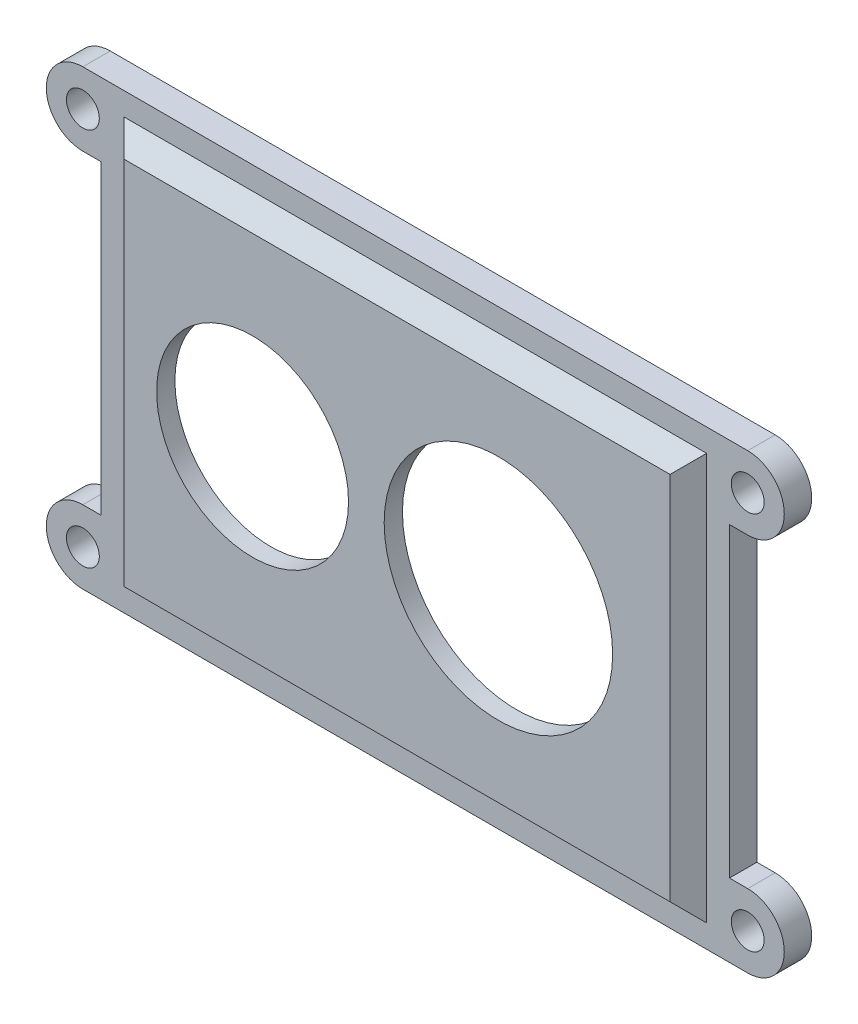
from build123d import *

# Parameters (mm, degrees)
ESBO_O1_W                = 68.75
ESBO_O1_H                = 49.5
RESSALTO_EXTRUS_O1_DEPTH = 5
ESBO_O2_W                = 60.75
ESBO_O2_H                = 41
CORTE_EXTRUS_O1_DEPTH    = 3
ESBO_O3_R                = 1.8
RESSALTO_EXTRUS_O2_DEPTH = 3
ESBO_O4_W                = 68.75
ESBO_O4_H                = 49.5
ESBO_O4_W_2              = 63.75
ESBO_O4_H_2              = 44.5
CORTE_EXTRUS_O2_DEPTH    = 2
CHANFRO1_SIZE            = 2
ESBO_O6_R                = 10.499996118
ESBO_O6_R_2              = 12.499999064
CORTE_EXTRUS_O4_DEPTH    = 48.620406603


with BuildPart() as part:
    # Esboço1 → Ressalto-extrusão1 (new body)
    with BuildSketch(Plane.XY):
        Rectangle(ESBO_O1_W, ESBO_O1_H)
    extrude(amount=RESSALTO_EXTRUS_O1_DEPTH)

    # Esboço2 → Corte-extrusão1 (cut)
    with BuildSketch(Plane(origin=(0, 0, 0), x_dir=(-1, 0, 0), z_dir=(0, 0, -1))):
        Rectangle(ESBO_O2_W, ESBO_O2_H)
    extrude(amount=-CORTE_EXTRUS_O1_DEPTH, mode=Mode.SUBTRACT)

    # Esboço3 → Ressalto-extrusão2 (add)
    # profile 1 of 4: a face of its own
    with BuildSketch(Plane(origin=(0, 0, 0), x_dir=(-1, 0, 0), z_dir=(0, 0, -1))):
        with BuildLine():
            Line((-36.375, 24.75), (-34.375, 24.75))
            Line((-34.375, 24.75), (-34.375, 16.75))
            Line((-34.375, 16.75), (-36.375, 16.75))
            ThreePointArc((-36.375, 16.75), (-40.375, 20.75), (-36.375, 24.75))
        make_face()
        with Locations((-36.375, 20.75)):
            Circle(ESBO_O3_R, mode=Mode.SUBTRACT)
    # profile 2 of 4: a face of its own
    with BuildSketch(Plane(origin=(0, 0, 0), x_dir=(-1, 0, 0), z_dir=(0, 0, -1))):
        with BuildLine():
            Line((34.375, 16.75), (36.375, 16.75))
            ThreePointArc((36.375, 16.75), (40.375, 20.75), (36.375, 24.75))
            Line((36.375, 24.75), (34.375, 24.75))
            Line((34.375, 24.75), (34.375, 16.75))
        make_face()
        with Locations(Location((36.375, 20.75, 0), (0, 0, 180))):
            Circle(ESBO_O3_R, mode=Mode.SUBTRACT)
    # profile 3 of 4: a face of its own
    with BuildSketch(Plane(origin=(0, 0, 0), x_dir=(-1, 0, 0), z_dir=(0, 0, -1))):
        with BuildLine():
            Line((36.375, -24.75), (34.375, -24.75))
            Line((34.375, -24.75), (34.375, -16.75))
            Line((34.375, -16.75), (36.375, -16.75))
            ThreePointArc((36.375, -16.75), (40.375, -20.75), (36.375, -24.75))
        make_face()
        with Locations((36.375, -20.75)):
            Circle(ESBO_O3_R, mode=Mode.SUBTRACT)
    # profile 4 of 4: a face of its own
    with BuildSketch(Plane(origin=(0, 0, 0), x_dir=(-1, 0, 0), z_dir=(0, 0, -1))):
        with BuildLine():
            Line((-34.375, -16.75), (-36.375, -16.75))
            ThreePointArc((-36.375, -16.75), (-40.375, -20.75), (-36.375, -24.75))
            Line((-36.375, -24.75), (-34.375, -24.75))
            Line((-34.375, -24.75), (-34.375, -16.75))
        make_face()
        with Locations(Location((-36.375, -20.75, 0), (0, 0, 180))):
            Circle(ESBO_O3_R, mode=Mode.SUBTRACT)
    extrude(amount=-RESSALTO_EXTRUS_O2_DEPTH)

    # Esboço4 → Corte-extrusão2 (cut)
    with BuildSketch(Plane.XY.offset(5)):
        Rectangle(ESBO_O4_W, ESBO_O4_H)
        Rectangle(ESBO_O4_W_2, ESBO_O4_H_2, mode=Mode.SUBTRACT)
    extrude(amount=-CORTE_EXTRUS_O2_DEPTH, mode=Mode.SUBTRACT)

    # Chanfro1
    chanfro1_edges = [part.edges().sort_by_distance(p)[0] for p in [
        (31.875, 0, 5),
        (0, -22.25, 5),
        (-31.875, 0, 5),
        (0, 22.25, 5),
    ]]
    chamfer(chanfro1_edges, length=CHANFRO1_SIZE - 0.0001)  # a hair under: the kernel refuses the full size

    # Esboço6 → Corte-extrusão4 (cut, through all)
    with BuildSketch(Plane.XY.offset(5)):
        with Locations((-15.805529429, 0.050006416)):
            Circle(ESBO_O6_R)
        with Locations((11.094471539, 0.049998219)):
            Circle(ESBO_O6_R_2)
    extrude(amount=-CORTE_EXTRUS_O4_DEPTH, mode=Mode.SUBTRACT)


solid = part.part
